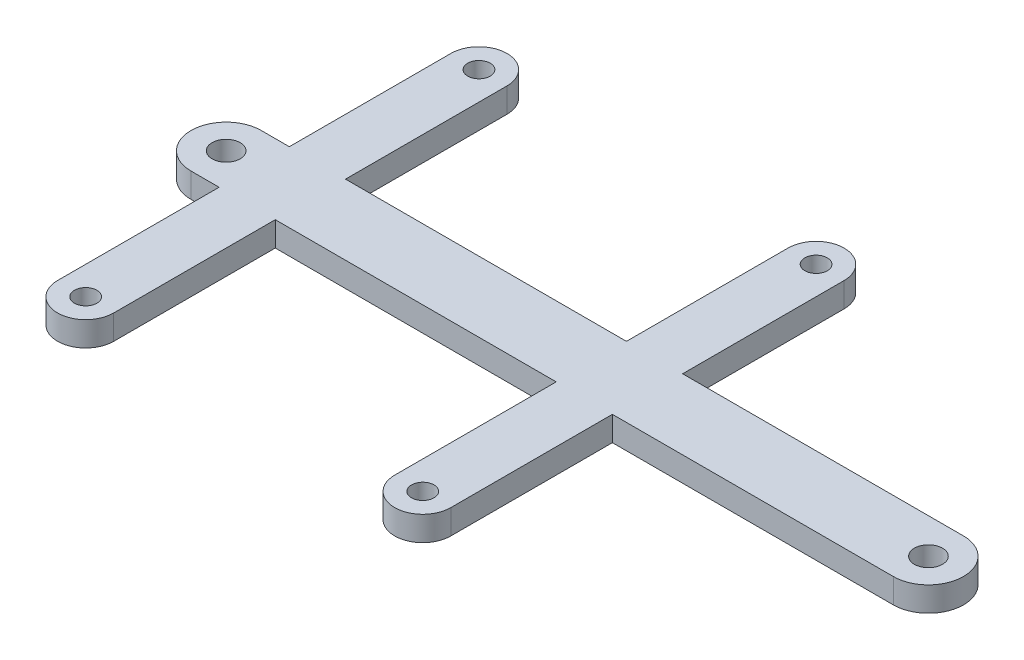
from build123d import *

# Parameters (mm, degrees)
SKETCH1_R           = 1.6
SKETCH1_R_2         = 2
BOSS_EXTRUDE1_DEPTH = 3.5


with BuildPart() as part:
    # Sketch1 → Boss-Extrude1 (new body)
    with BuildSketch(Plane(origin=(0, 0, 0), x_dir=(1, 0, 0), z_dir=(0, 1, 0))):
        with BuildLine():
            Line((10, 5), (10, 28))
            ThreePointArc((10, 28), (6, 32), (2, 28))
            Line((2, 28), (2, 5))
            Line((2, 5), (-38, 5))
            Line((-38, 5), (-38, 28))
            ThreePointArc((-38, 28), (-42, 32), (-46, 28))
            Line((-46, 28), (-46, 5))
            Line((-46, 5), (-50, 5))
            ThreePointArc((-50, 5), (-55, 0), (-50, -5))
            Line((-50, -5), (-46, -5))
            Line((-46, -5), (-46, -28))
            ThreePointArc((-46, -28), (-42, -32), (-38, -28))
            Line((-38, -28), (-38, -5))
            Line((-38, -5), (2, -5))
            Line((2, -5), (2, -28))
            ThreePointArc((2, -28), (6, -32), (10, -28))
            Line((10, -28), (10, -5))
            Line((10, -5), (50, -5))
            ThreePointArc((50, -5), (55, 0), (50, 5))
            Line((50, 5), (10, 5))
        make_face()
        with Locations((-42, -28)):
            Circle(SKETCH1_R, mode=Mode.SUBTRACT)
        with Locations((6, -28)):
            Circle(SKETCH1_R, mode=Mode.SUBTRACT)
        with Locations((-50, 0)):
            Circle(SKETCH1_R_2, mode=Mode.SUBTRACT)
        with Locations((-42, 28)):
            Circle(SKETCH1_R, mode=Mode.SUBTRACT)
        with Locations((50, 0)):
            Circle(SKETCH1_R_2, mode=Mode.SUBTRACT)
        with Locations((6, 28)):
            Circle(SKETCH1_R, mode=Mode.SUBTRACT)
    extrude(amount=BOSS_EXTRUDE1_DEPTH)


solid = part.part
